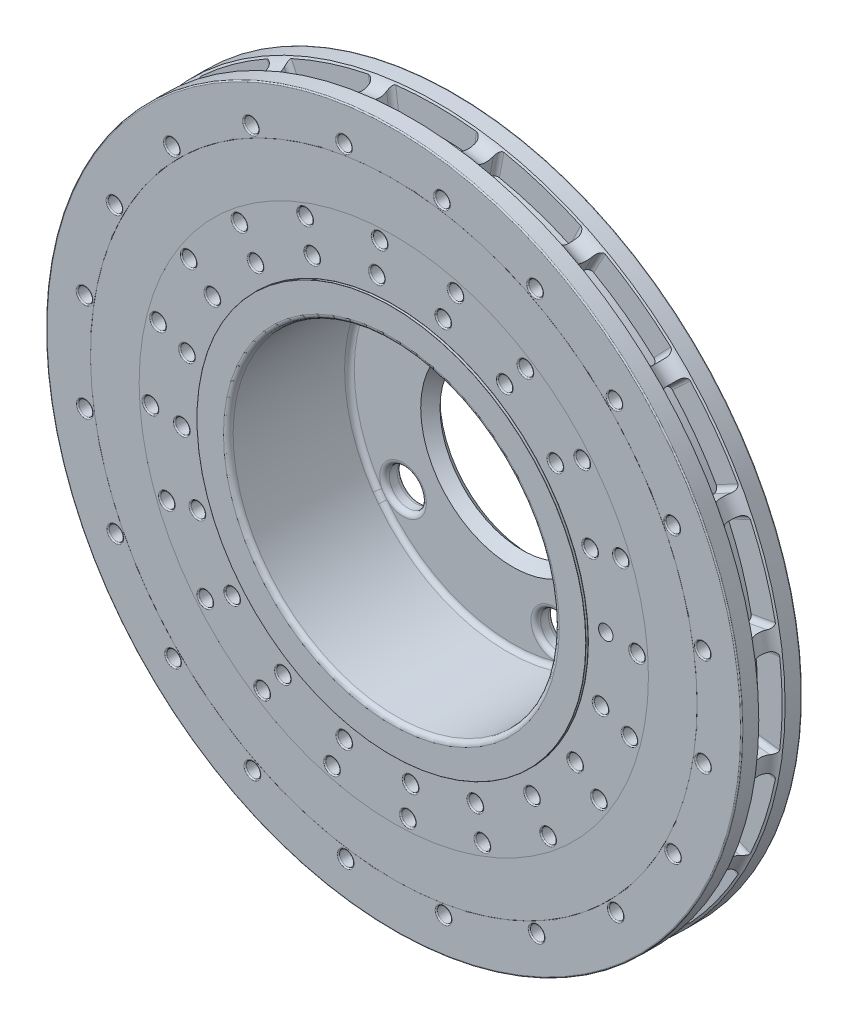
from build123d import *
from build123d.topology import SkipClean

# Parameters (mm, degrees)
BOSS_EXTRUDE1_START      = 2.5
SKETCH2_R                = 144
BOSS_EXTRUDE1_DEPTH      = 10
SKETCH3_R                = 80.5
BOSS_EXTRUDE2_DEPTH      = 1
CUT_EXTRUDE4_DEPTH       = 205.093728468
CUT_EXTRUDE4_DEPTH_BACK  = 205.093728468
SKETCH4_R                = 67.5
SKETCH5_R                = 74.125
BOSS_EXTRUDE5_DEPTH      = 46.33
CUT_EXTRUDE5_START       = -46.33
SKETCH6_R                = 67.5
CUT_EXTRUDE5_DEPTH       = 46.33
BOSS_EXTRUDE6_START      = -7.2
SKETCH13_R               = 74.125
BOSS_EXTRUDE6_DEPTH      = 7.2
SKETCH14_R               = 34
CUT_EXTRUDE6_DEPTH       = 209.310030723
BOSS_EXTRUDE7_START      = 15
SKETCH15_R               = 144
SKETCH15_R_2             = 80.5
BOSS_EXTRUDE7_DEPTH      = 15
SKETCH16_W               = 10
SKETCH16_H               = 22
CUT_REVOLVE1_ANGLE       = 15
FILLET1_R                = 2
CIRPATTERN1_COUNT        = 20
FILLET1_OF_CIRPATTERN1_R = 2
SKETCH17_R               = 6
CHAMFER1_SIZE            = 4
CHAMFER2_SIZE            = 3.2
SKETCH18_R               = 7.65
CUT_EXTRUDE7_DEPTH       = 209.310030862
CIRPATTERN3_COUNT        = 5
FILLET2_R                = 4
FILLET3_R                = 2
FILLET4_R                = 2
FILLET5_R                = 2
FILLET6_R                = 0.05
FILLET7_R                = 0.5
SKETCH20_R               = 3
CUT_EXTRUDE8_DEPTH       = 212.293797753
CRVPATTERN1_START        = -12.5
CRVPATTERN1_OUTLINE_R    = 3
CRVPATTERN1_DEPTH        = 25.5
CIRPATTERN4_COUNT        = 20
FILLET8_R                = 0.5
SKETCH21_R               = 125.502524967
SKETCH21_R_2             = 105.384429754
BOSS_EXTRUDE8_DEPTH      = 12.5005


with BuildPart() as part:
    # Sketch2 → Boss-Extrude1 (new body)
    with BuildSketch(Plane.XY.offset(BOSS_EXTRUDE1_START)):
        Circle(SKETCH2_R)
    extrude(amount=BOSS_EXTRUDE1_DEPTH)

    # Sketch3 → Boss-Extrude2 (add)
    with BuildSketch(Plane.XY.offset(12.5)):
        Circle(SKETCH3_R)
    extrude(amount=BOSS_EXTRUDE2_DEPTH)

    # Sketch4 → Cut-Extrude4 (cut, two sides: drawn at the far end of the back side and taken through both)
    with BuildSketch(Plane.XY.offset(-CUT_EXTRUDE4_DEPTH_BACK)):
        Circle(SKETCH4_R)
    extrude(amount=CUT_EXTRUDE4_DEPTH + CUT_EXTRUDE4_DEPTH_BACK, mode=Mode.SUBTRACT)

    # Sketch5 → Boss-Extrude5 (add)
    with BuildSketch(Plane(origin=(0, 0, 2.5), x_dir=(-1, 0, 0), z_dir=(0, 0, -1))):
        with Locations(Location((0, 0, 0), (0, 0, 180))):
            Circle(SKETCH5_R)
    extrude(amount=BOSS_EXTRUDE5_DEPTH)

    # Sketch6 → Cut-Extrude5 (cut)
    with BuildSketch(Plane.XY.offset(2.5).offset(CUT_EXTRUDE5_START)):
        Circle(SKETCH6_R)
    extrude(amount=CUT_EXTRUDE5_DEPTH, mode=Mode.SUBTRACT)

    # Sketch13 → Boss-Extrude6 (add)
    with BuildSketch(Plane(origin=(0, 0, -43.83), x_dir=(-1, 0, 0), z_dir=(0, 0, -1)).offset(BOSS_EXTRUDE6_START)):
        with Locations(Location((0, 0, 0), (0, 0, 180))):
            Circle(SKETCH13_R)
    extrude(amount=BOSS_EXTRUDE6_DEPTH)

    # Sketch14 → Cut-Extrude6 (cut, through all)
    with BuildSketch(Plane.XY):
        Circle(SKETCH14_R)
    extrude(amount=-CUT_EXTRUDE6_DEPTH, mode=Mode.SUBTRACT)

    # Sketch15 → Boss-Extrude7 (add)
    with BuildSketch(Plane(origin=(0, 0, 2.5), x_dir=(-1, 0, 0), z_dir=(0, 0, -1)).offset(BOSS_EXTRUDE7_START)):
        Circle(SKETCH15_R)
        with Locations(Location((0, 0, 0), (0, 0, 180))):
            Circle(SKETCH15_R_2, mode=Mode.SUBTRACT)
    extrude(amount=-BOSS_EXTRUDE7_DEPTH)

    # Sketch16 → Cut-Revolve1 (revolve, symmetric, cut)
    with BuildSketch(Plane(origin=(0, 0, 0), x_dir=(0, 0, -1), z_dir=(1, 0, 0))) as cut_revolve1_sk:
        with Locations((0, 144)):
            Rectangle(SKETCH16_W, SKETCH16_H)
    cut_revolve1 = revolve(axis=Axis((0, 0, 55), (0, 0, -1)), revolution_arc=CUT_REVOLVE1_ANGLE / 2, mode=Mode.SUBTRACT)
    cut_revolve1 = cut_revolve1 + revolve(cut_revolve1_sk.sketch, axis=Axis((0, 0, 55), (0, 0, 1)), revolution_arc=CUT_REVOLVE1_ANGLE / 2, mode=Mode.SUBTRACT)

    # Fillet1
    fillet1_edges = [part.edges().sort_by_distance(p)[0] for p in [
        (-18.077877622, 137.3151133, -5),
        (-18.077877622, 137.3151133, 5),
        (18.077877622, 137.3151133, 5),
        (18.077877622, 137.3151133, -5),
    ]]
    fillet(fillet1_edges, radius=FILLET1_R)

    # CirPattern1: Cut-Revolve1 ×20 about axis
    with SkipClean():  # the faces are left unmerged after this step: merging them gives an invalid solid
        cirpattern1_axis = Axis((0, 0, 0), (0, 0, 1))
        for i in range(1, CIRPATTERN1_COUNT):
            add(cut_revolve1.rotate(cirpattern1_axis, i * 360 / CIRPATTERN1_COUNT), mode=Mode.SUBTRACT)

    # Fillet1 of CirPattern1
    fillet1_of_cirpattern1_edges = [part.edges().sort_by_distance(p)[0] for p in [
        (-59.625786908, 125.008061882, -5),
        (-59.625786908, 125.008061882, 5),
        (-25.239620281, 136.180804698, 5),
        (-25.239620281, 136.180804698, -5),
        (-95.337108734, 100.464350385, -5),
        (-95.337108734, 100.464350385, 5),
        (-66.086488296, 121.716170104, 5),
        (-66.086488296, 121.716170104, -5),
        (-121.716170104, 66.086488296, -5),
        (-121.716170104, 66.086488296, 5),
        (-100.464350385, 95.337108734, 5),
        (-100.464350385, 95.337108734, -5),
        (-136.180804698, 25.239620281, -5),
        (-136.180804698, 25.239620281, 5),
        (-125.008061882, 59.625786908, 5),
        (-125.008061882, 59.625786908, -5),
        (-137.3151133, -18.077877622, -5),
        (-137.3151133, -18.077877622, 5),
        (-137.3151133, 18.077877622, 5),
        (-137.3151133, 18.077877622, -5),
        (-125.008061882, -59.625786908, -5),
        (-125.008061882, -59.625786908, 5),
        (-136.180804698, -25.239620281, 5),
        (-136.180804698, -25.239620281, -5),
        (-100.464350385, -95.337108734, -5),
        (-100.464350385, -95.337108734, 5),
        (-121.716170104, -66.086488296, 5),
        (-121.716170104, -66.086488296, -5),
        (-66.086488296, -121.716170104, -5),
        (-66.086488296, -121.716170104, 5),
        (-95.337108734, -100.464350385, 5),
        (-95.337108734, -100.464350385, -5),
        (-25.239620281, -136.180804698, -5),
        (-25.239620281, -136.180804698, 5),
        (-59.625786908, -125.008061882, 5),
        (-59.625786908, -125.008061882, -5),
        (18.077877622, -137.3151133, -5),
        (18.077877622, -137.3151133, 5),
        (-18.077877622, -137.3151133, 5),
        (-18.077877622, -137.3151133, -5),
        (59.625786908, -125.008061882, -5),
        (59.625786908, -125.008061882, 5),
        (25.239620281, -136.180804698, 5),
        (25.239620281, -136.180804698, -5),
        (95.337108734, -100.464350385, -5),
        (95.337108734, -100.464350385, 5),
        (66.086488296, -121.716170104, 5),
        (66.086488296, -121.716170104, -5),
        (121.716170104, -66.086488296, -5),
        (121.716170104, -66.086488296, 5),
        (100.464350385, -95.337108734, 5),
        (100.464350385, -95.337108734, -5),
        (136.180804698, -25.239620281, -5),
        (136.180804698, -25.239620281, 5),
        (125.008061882, -59.625786908, 5),
        (125.008061882, -59.625786908, -5),
        (137.3151133, 18.077877622, -5),
        (137.3151133, 18.077877622, 5),
        (137.3151133, -18.077877622, 5),
        (137.3151133, -18.077877622, -5),
        (125.008061882, 59.625786908, -5),
        (125.008061882, 59.625786908, 5),
        (136.180804698, 25.239620281, 5),
        (136.180804698, 25.239620281, -5),
        (100.464350385, 95.337108734, -5),
        (100.464350385, 95.337108734, 5),
        (121.716170104, 66.086488296, 5),
        (121.716170104, 66.086488296, -5),
        (66.086488296, 121.716170104, -5),
        (66.086488296, 121.716170104, 5),
        (95.337108734, 100.464350385, 5),
        (95.337108734, 100.464350385, -5),
        (25.239620281, 136.180804698, -5),
        (25.239620281, 136.180804698, 5),
        (59.625786908, 125.008061882, 5),
        (59.625786908, 125.008061882, -5),
    ]]
    fillet(fillet1_of_cirpattern1_edges, radius=FILLET1_OF_CIRPATTERN1_R)

    # Sketch17 → Cut-Revolve2 (revolve, cut)
    with BuildSketch(Plane(origin=(0, 0, 0), x_dir=(0, 0, -1), z_dir=(1, 0, 0)), mode=Mode.PRIVATE) as cut_revolve2_sk:
        with Locations((0, 146.5)):
            Circle(SKETCH17_R)
    revolve(cut_revolve2_sk.sketch.rotate(Axis((0, 0, 55), (0, 0, -1)), 270), axis=Axis((0, 0, 55), (0, 0, -1)), mode=Mode.SUBTRACT)

    # Chamfer1
    chamfer1_edges = [part.edges().sort_by_distance(p)[0] for p in [
        (-34, 0, -36.63),
    ]]
    chamfer(chamfer1_edges, length=CHAMFER1_SIZE)

    # Chamfer2
    chamfer2_edges = [part.edges().sort_by_distance(p)[0] for p in [
        (-34, 0, -43.83),
    ]]
    chamfer(chamfer2_edges, length=CHAMFER2_SIZE - 0.0001)  # a hair under: the kernel refuses the full size

    # Sketch18 → Cut-Extrude7 (cut, symmetric)
    with BuildSketch(Plane.XY):
        with Locations((56, 0)):
            Circle(SKETCH18_R)
    cut_extrude7 = extrude(amount=CUT_EXTRUDE7_DEPTH, both=True, mode=Mode.SUBTRACT)

    # CirPattern3: Cut-Extrude7 ×5 about axis
    cirpattern3_axis = Axis((0, 0, 0), (0, 0, 1))
    for i in range(1, CIRPATTERN3_COUNT):
        add(cut_extrude7.rotate(cirpattern3_axis, i * 360 / CIRPATTERN3_COUNT), mode=Mode.SUBTRACT)

    # Fillet2
    fillet2_edges = [part.edges().sort_by_distance(p)[0] for p in [
        (-74.125, 0, -43.83),
    ]]
    fillet(fillet2_edges, radius=FILLET2_R)

    # Fillet3
    fillet3_edges = [part.edges().sort_by_distance(p)[0] for p in [
        (48.35, 0, -43.83),
        (48.35, 0, -36.63),
        (14.940971678, -45.983582563, -43.83),
        (14.940971678, -45.983582563, -36.63),
        (-39.115971678, -28.419416948, -43.83),
        (-39.115971678, -28.419416948, -36.63),
        (-39.115971678, 28.419416948, -43.83),
        (-39.115971678, 28.419416948, -36.63),
        (14.940971678, 45.983582563, -43.83),
        (14.940971678, 45.983582563, -36.63),
    ]]
    fillet(fillet3_edges, radius=FILLET3_R)

    # Fillet4
    fillet4_edges = [part.edges().sort_by_distance(p)[0] for p in [
        (-74.125, 0, 2.5),
        (-80.5, 0, 2.5),
        (-80.5, 0, -12.5),
    ]]
    fillet(fillet4_edges, radius=FILLET4_R)

    # Fillet5
    fillet5_edges = [part.edges().sort_by_distance(p)[0] for p in [
        (-67.5, 0, 13.5),
        (-67.5, 0, -36.63),
    ]]
    fillet(fillet5_edges, radius=FILLET5_R)

    # Fillet6
    fillet6_edges = [part.edges().sort_by_distance(p)[0] for p in [
        (-80.5, 0, 12.5),
        (-80.5, 0, 13.5),
    ]]
    fillet(fillet6_edges, radius=FILLET6_R)

    # Fillet7
    fillet7_edges = [part.edges().sort_by_distance(p)[0] for p in [
        (144, 0, -12.5),
        (-144, 0, 12.5),
    ]]
    fillet(fillet7_edges, radius=FILLET7_R)

    # Sketch20 → Cut-Extrude8 (cut, through all)
    with BuildSketch(Plane.XY.offset(12.5)):
        with Locations((87.722666739, 6.980955541)):
            Circle(SKETCH20_R)
    cut_extrude8 = extrude(amount=-CUT_EXTRUDE8_DEPTH, mode=Mode.SUBTRACT)

    # CrvPattern1: read off the stored shape, not the designer's step
    # CrvPattern1 outline → CrvPattern1 (cut)
    with BuildSketch(Plane.XY.offset(CRVPATTERN1_START)):
        with Locations((127.982780401, -19.9099955)):
            Circle(CRVPATTERN1_OUTLINE_R)
        with Locations((121.974663655, -8.389243089)):
            Circle(CRVPATTERN1_OUTLINE_R)
        with Locations((112.520487904, 0.523880034)):
            Circle(CRVPATTERN1_OUTLINE_R)
        with Locations((100.666052185, 5.843424821)):
            Circle(CRVPATTERN1_OUTLINE_R)
    crvpattern1 = extrude(amount=CRVPATTERN1_DEPTH, mode=Mode.SUBTRACT)

    # CirPattern4: Cut-Extrude8, CrvPattern1 ×20 about axis
    cirpattern4_axis = Axis((0, 0, 0), (0, 0, 1))
    add([cut_extrude8.rotate(cirpattern4_axis, i * 360 / CIRPATTERN4_COUNT) for i in range(1, CIRPATTERN4_COUNT)], mode=Mode.SUBTRACT)
    add([crvpattern1.rotate(cirpattern4_axis, i * 360 / CIRPATTERN4_COUNT) for i in range(1, CIRPATTERN4_COUNT)], mode=Mode.SUBTRACT)

    # Fillet8
    fillet8_edges = [part.edges().sort_by_distance(p)[0] for p in [
        (97.666052185, 5.843424821, -12.5),
        (97.666052185, 5.843424821, 12.5),
        (109.520487904, 0.523880034, -12.5),
        (109.520487904, 0.523880034, 12.5),
        (118.974663655, -8.389243089, -12.5),
        (118.974663655, -8.389243089, 12.5),
        (124.982780401, -19.9099955, -12.5),
        (124.982780401, -19.9099955, 12.5),
        (82.733278179, -19.541460574, -12.5),
        (82.733278179, -19.541460574, 12.5),
        (94.691652926, -24.623042645, -12.5),
        (94.691652926, -24.623042645, 12.5),
        (104.322061522, -33.345452474, -12.5),
        (104.322061522, -33.345452474, 12.5),
        (110.559210459, -44.743837276, -12.5),
        (110.559210459, -44.743837276, 12.5),
        (112.713160758, -57.557334108, -12.5),
        (112.713160758, -57.557334108, 12.5),
        (72.645379914, -44.151022375, -12.5),
        (72.645379914, -44.151022375, 12.5),
        (82.448174924, -52.679235138, -12.5),
        (82.448174924, -52.679235138, 12.5),
        (88.911864905, -63.950699763, -12.5),
        (88.911864905, -63.950699763, 12.5),
        (91.321451431, -76.718592922, -12.5),
        (91.321451431, -76.718592922, 12.5),
        (89.410391621, -89.570559828, -12.5),
        (89.410391621, -89.570559828, 12.5),
        (55.446445713, -64.438774487, -12.5),
        (55.446445713, -64.438774487, 12.5),
        (62.13409511, -75.578817059, -12.5),
        (62.13409511, -75.578817059, 12.5),
        (64.798355464, -88.296006989, -12.5),
        (64.798355464, -88.296006989, 12.5),
        (63.144512464, -101.183598163, -12.5),
        (63.144512464, -101.183598163, 12.5),
        (57.355510393, -112.815995077, -12.5),
        (57.355510393, -112.815995077, 12.5),
        (32.820027088, -78.418810381, -12.5),
        (32.820027088, -78.418810381, 12.5),
        (35.737897152, -91.080217776, -12.5),
        (35.737897152, -91.080217776, 12.5),
        (34.341931515, -103.998285855, -12.5),
        (34.341931515, -103.998285855, 12.5),
        (28.786548663, -115.744047828, -12.5),
        (28.786548663, -115.744047828, 12.5),
        (19.686272188, -125.018214692, -12.5),
        (19.686272188, -125.018214692, 12.5),
        (6.980955541, -84.722666739, -12.5),
        (6.980955541, -84.722666739, 12.5),
        (5.843424821, -97.666052185, -12.5),
        (5.843424821, -97.666052185, 12.5),
        (0.523880034, -109.520487904, -12.5),
        (0.523880034, -109.520487904, 12.5),
        (-8.389243089, -118.974663655, -12.5),
        (-8.389243089, -118.974663655, 12.5),
        (-19.9099955, -124.982780401, -12.5),
        (-19.9099955, -124.982780401, 12.5),
        (-19.541460574, -82.733278179, -12.5),
        (-19.541460574, -82.733278179, 12.5),
        (-24.623042645, -94.691652926, -12.5),
        (-24.623042645, -94.691652926, 12.5),
        (-33.345452474, -104.322061522, -12.5),
        (-33.345452474, -104.322061522, 12.5),
        (-44.743837276, -110.559210459, -12.5),
        (-44.743837276, -110.559210459, 12.5),
        (-57.557334108, -112.713160758, -12.5),
        (-57.557334108, -112.713160758, 12.5),
        (-44.151022375, -72.645379914, -12.5),
        (-44.151022375, -72.645379914, 12.5),
        (-52.679235138, -82.448174924, -12.5),
        (-52.679235138, -82.448174924, 12.5),
        (-63.950699763, -88.911864905, -12.5),
        (-63.950699763, -88.911864905, 12.5),
        (-76.718592922, -91.321451431, -12.5),
        (-76.718592922, -91.321451431, 12.5),
        (-89.570559828, -89.410391621, -12.5),
        (-89.570559828, -89.410391621, 12.5),
        (-64.438774487, -55.446445713, -12.5),
        (-64.438774487, -55.446445713, 12.5),
        (-75.578817059, -62.13409511, -12.5),
        (-75.578817059, -62.13409511, 12.5),
        (-88.296006989, -64.798355464, -12.5),
        (-88.296006989, -64.798355464, 12.5),
        (-101.183598163, -63.144512464, -12.5),
        (-101.183598163, -63.144512464, 12.5),
        (-112.815995077, -57.355510393, -12.5),
        (-112.815995077, -57.355510393, 12.5),
        (-78.418810381, -32.820027088, -12.5),
        (-78.418810381, -32.820027088, 12.5),
        (-91.080217776, -35.737897152, -12.5),
        (-91.080217776, -35.737897152, 12.5),
        (-103.998285855, -34.341931515, -12.5),
        (-103.998285855, -34.341931515, 12.5),
        (-115.744047828, -28.786548663, -12.5),
        (-115.744047828, -28.786548663, 12.5),
        (-125.018214692, -19.686272188, -12.5),
        (-125.018214692, -19.686272188, 12.5),
        (-84.722666739, -6.980955541, -12.5),
        (-84.722666739, -6.980955541, 12.5),
        (-97.666052185, -5.843424821, -12.5),
        (-97.666052185, -5.843424821, 12.5),
        (-109.520487904, -0.523880034, -12.5),
        (-109.520487904, -0.523880034, 12.5),
        (-118.974663655, 8.389243089, -12.5),
        (-118.974663655, 8.389243089, 12.5),
        (-124.982780401, 19.9099955, -12.5),
        (-124.982780401, 19.9099955, 12.5),
        (-82.733278179, 19.541460574, -12.5),
        (-82.733278179, 19.541460574, 12.5),
        (-94.691652926, 24.623042645, -12.5),
        (-94.691652926, 24.623042645, 12.5),
        (-104.322061522, 33.345452474, -12.5),
        (-104.322061522, 33.345452474, 12.5),
        (-110.559210459, 44.743837276, -12.5),
        (-110.559210459, 44.743837276, 12.5),
        (-112.713160758, 57.557334108, -12.5),
        (-112.713160758, 57.557334108, 12.5),
        (-72.645379914, 44.151022375, -12.5),
        (-72.645379914, 44.151022375, 12.5),
        (-82.448174924, 52.679235138, -12.5),
        (-82.448174924, 52.679235138, 12.5),
        (-88.911864905, 63.950699763, -12.5),
        (-88.911864905, 63.950699763, 12.5),
        (-91.321451431, 76.718592922, -12.5),
        (-91.321451431, 76.718592922, 12.5),
        (-89.410391621, 89.570559828, -12.5),
        (-89.410391621, 89.570559828, 12.5),
        (-55.446445713, 64.438774487, -12.5),
        (-55.446445713, 64.438774487, 12.5),
        (-62.13409511, 75.578817059, -12.5),
        (-62.13409511, 75.578817059, 12.5),
        (-64.798355464, 88.296006989, -12.5),
        (-64.798355464, 88.296006989, 12.5),
        (-63.144512464, 101.183598163, -12.5),
        (-63.144512464, 101.183598163, 12.5),
        (-57.355510393, 112.815995077, -12.5),
        (-57.355510393, 112.815995077, 12.5),
        (-32.820027088, 78.418810381, -12.5),
        (-32.820027088, 78.418810381, 12.5),
        (-35.737897152, 91.080217776, -12.5),
        (-35.737897152, 91.080217776, 12.5),
        (-34.341931515, 103.998285855, -12.5),
        (-34.341931515, 103.998285855, 12.5),
        (-28.786548663, 115.744047828, -12.5),
        (-28.786548663, 115.744047828, 12.5),
        (-19.686272188, 125.018214692, -12.5),
        (-19.686272188, 125.018214692, 12.5),
        (-6.980955541, 84.722666739, -12.5),
        (-6.980955541, 84.722666739, 12.5),
        (-5.843424821, 97.666052185, -12.5),
        (-5.843424821, 97.666052185, 12.5),
        (-0.523880034, 109.520487904, -12.5),
        (-0.523880034, 109.520487904, 12.5),
        (8.389243089, 118.974663655, -12.5),
        (8.389243089, 118.974663655, 12.5),
        (19.9099955, 124.982780401, -12.5),
        (19.9099955, 124.982780401, 12.5),
        (19.541460574, 82.733278179, -12.5),
        (19.541460574, 82.733278179, 12.5),
        (24.623042645, 94.691652926, -12.5),
        (24.623042645, 94.691652926, 12.5),
        (33.345452474, 104.322061522, -12.5),
        (33.345452474, 104.322061522, 12.5),
        (44.743837276, 110.559210459, -12.5),
        (44.743837276, 110.559210459, 12.5),
        (57.557334108, 112.713160758, -12.5),
        (57.557334108, 112.713160758, 12.5),
        (44.151022375, 72.645379914, -12.5),
        (44.151022375, 72.645379914, 12.5),
        (52.679235138, 82.448174924, -12.5),
        (52.679235138, 82.448174924, 12.5),
        (63.950699763, 88.911864905, -12.5),
        (63.950699763, 88.911864905, 12.5),
        (76.718592922, 91.321451431, -12.5),
        (76.718592922, 91.321451431, 12.5),
        (89.570559828, 89.410391621, -12.5),
        (89.570559828, 89.410391621, 12.5),
        (64.438774487, 55.446445713, -12.5),
        (64.438774487, 55.446445713, 12.5),
        (75.578817059, 62.13409511, -12.5),
        (75.578817059, 62.13409511, 12.5),
        (88.296006989, 64.798355464, -12.5),
        (88.296006989, 64.798355464, 12.5),
        (101.183598163, 63.144512464, -12.5),
        (101.183598163, 63.144512464, 12.5),
        (112.815995077, 57.355510393, -12.5),
        (112.815995077, 57.355510393, 12.5),
        (78.418810381, 32.820027088, -12.5),
        (78.418810381, 32.820027088, 12.5),
        (91.080217776, 35.737897152, -12.5),
        (91.080217776, 35.737897152, 12.5),
        (103.998285855, 34.341931515, -12.5),
        (103.998285855, 34.341931515, 12.5),
        (115.744047828, 28.786548663, -12.5),
        (115.744047828, 28.786548663, 12.5),
        (125.018214692, 19.686272188, -12.5),
        (125.018214692, 19.686272188, 12.5),
    ]]
    fillet(fillet8_edges, radius=FILLET8_R)

    # Sketch21 → Boss-Extrude8 (add, symmetric)
    with BuildSketch(Plane.XY):
        with Locations(Location((0, 0, 0), (0, 0, 176.678117216))):
            Circle(SKETCH21_R)
        with Locations(Location((0, 0, 0), (0, 0, 180))):
            Circle(SKETCH21_R_2, mode=Mode.SUBTRACT)
    extrude(amount=BOSS_EXTRUDE8_DEPTH, both=True)


solid = part.part
